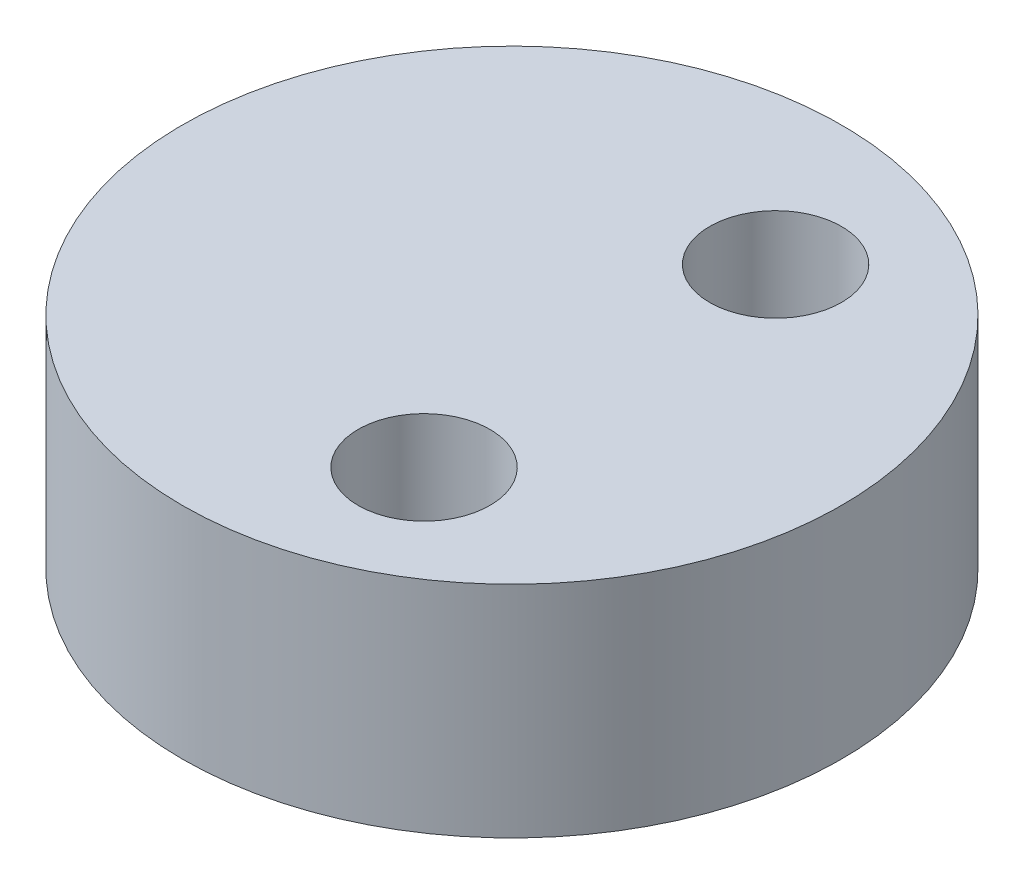
from build123d import *

# Parameters (mm, degrees)
SKETCH1_R           = 7.5
SKETCH1_R_2         = 1.5
BOSS_EXTRUDE1_DEPTH = 5


with BuildPart() as part:
    # Sketch1 → Boss-Extrude1 (new body)
    with BuildSketch(Plane(origin=(0, 0, 0), x_dir=(1, 0, 0), z_dir=(0, 1, 0))):
        with Locations((-2, 0)):
            Circle(SKETCH1_R)
        with Locations((0, 4)):
            Circle(SKETCH1_R_2, mode=Mode.SUBTRACT)
        with Locations((0, -4)):
            Circle(SKETCH1_R_2, mode=Mode.SUBTRACT)
    extrude(amount=BOSS_EXTRUDE1_DEPTH)


solid = part.part
